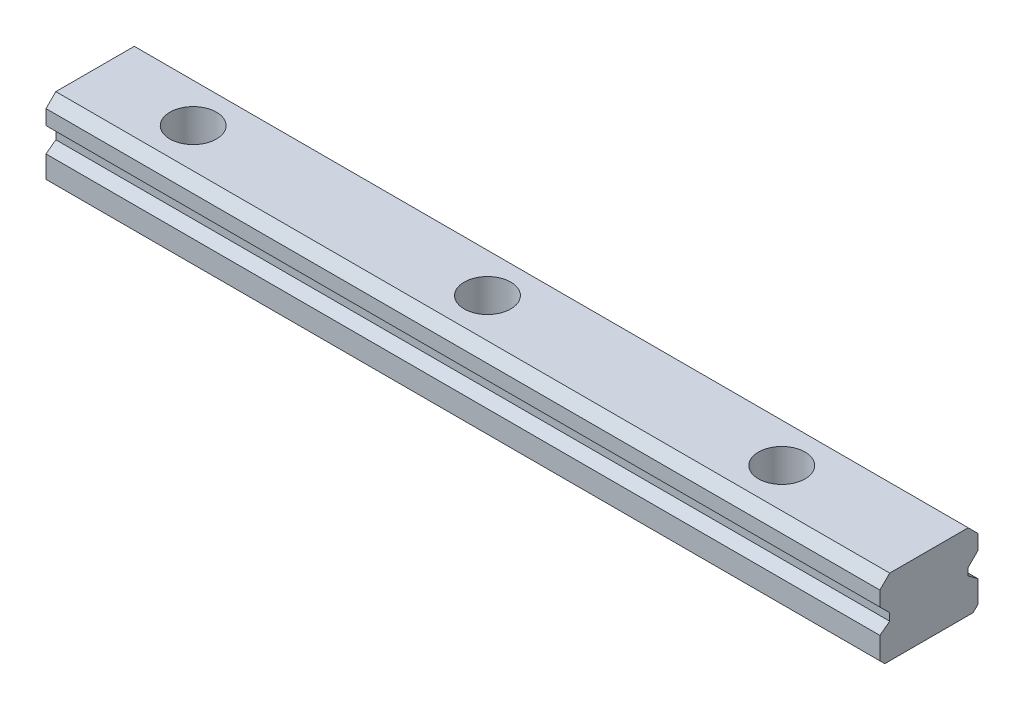
from build123d import *

# Parameters (mm, degrees)
BOSS_EXTRUDE1_DEPTH = 170
SKETCH2_R           = 4.75
CUT_EXTRUDE1_DEPTH  = 8.5
SKETCH3_R           = 3
CUT_EXTRUDE2_DEPTH  = 171.505865002
LPATTERN1_COUNT     = 3
LPATTERN1_PITCH     = 60


with BuildPart() as part:
    # Sketch1 → Boss-Extrude1 (new body)
    with BuildSketch(Plane(origin=(0, 0, 0), x_dir=(0, 0, -1), z_dir=(1, 0, 0))):
        Polygon((9, 0), (-9, 0), (-10, 1), (-10, 5.5), (-8, 7), (-8, 8.5), (-10, 10.5), (-10, 13.5), (-8, 15.5), (8, 15.5), (10, 13.5), (10, 10.5), (8, 8.5), (8, 7), (10, 5.5), (10, 1), align=None)
    extrude(amount=BOSS_EXTRUDE1_DEPTH)

    # Sketch2 → Cut-Extrude1 (cut)
    with BuildSketch(Plane(origin=(0, 15.5, 0), x_dir=(1, 0, 0), z_dir=(0, 1, 0))):
        with Locations((20, 0)):
            Circle(SKETCH2_R)
    cut_extrude1 = extrude(amount=-CUT_EXTRUDE1_DEPTH, mode=Mode.SUBTRACT)

    # Sketch3 → Cut-Extrude2 (cut, through all)
    with BuildSketch(Plane(origin=(0, 7, 0), x_dir=(1, 0, 0), z_dir=(0, 1, 0))):
        with Locations((20, 0)):
            Circle(SKETCH3_R)
    cut_extrude2 = extrude(amount=-CUT_EXTRUDE2_DEPTH, mode=Mode.SUBTRACT)

    # LPattern1: Cut-Extrude1, Cut-Extrude2 ×3
    with Locations(*[(i * LPATTERN1_PITCH, 0, 0) for i in range(1, LPATTERN1_COUNT)]):
        add(cut_extrude1, mode=Mode.SUBTRACT)
        add(cut_extrude2, mode=Mode.SUBTRACT)


solid = part.part
